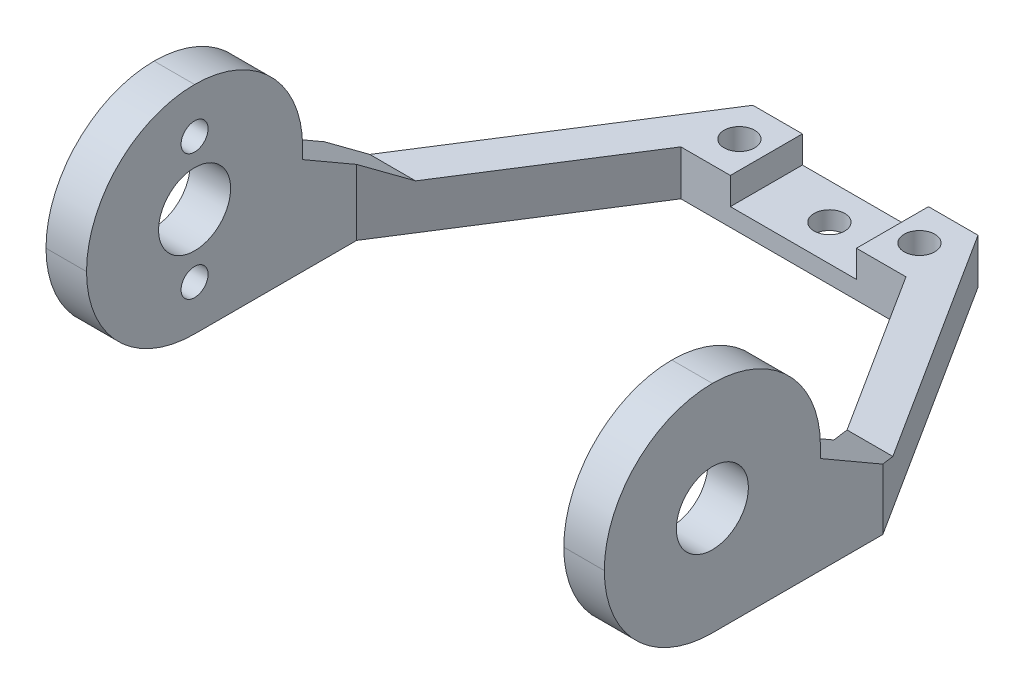
from build123d import *
from OCP.BRepFilletAPI import BRepFilletAPI_MakeChamfer

# Parameters (mm, degrees)
BOSS_EXTRUDE1_DEPTH     = 5
SKETCH2_W               = 4.5
SKETCH2_H               = 24
BOSS_EXTRUDE2_DEPTH     = 19
CUT_EXTRUDE1_REACH      = 59.853
SKETCH5_R               = 1.7
CUT_EXTRUDE2_REACH      = 73.673
SKETCH6_W               = 14
SKETCH6_H               = 3
CUT_EXTRUDE3_REACH      = 78.859
SKETCH7_R               = 1.5
CUT_EXTRUDE4_DEPTH      = 77.85863647
CUT_EXTRUDE4_DEPTH_BACK = 77.85863647
SKETCH8_R               = 4
FILLET1_R               = 12
CHAMFER2_SIZE           = 10
CHAMFER2_SIZE2          = 5.773502692
CUT_EXTRUDE5_REACH      = 59.853
SKETCH10_R              = 1.7


with BuildPart() as part:
    # Sketch1 → Boss-Extrude1 (new body)
    with BuildSketch(Plane(origin=(0, 0, 0), x_dir=(1, 0, 0), z_dir=(0, 1, 0))):
        Polygon((-31, 15.928571429), (-31, -15), (-26.5, -15), (-26.5, 15), (-12.5, 37), (12.5, 37), (26.5, 15), (26.5, -15), (31, -15), (31, 15.928571429), (12.5, 45), (-12.5, 45), align=None)
    extrude(amount=BOSS_EXTRUDE1_DEPTH)

    # Sketch2 → Boss-Extrude2 (add)
    with BuildSketch(Plane(origin=(0, 5, 0), x_dir=(1, 0, 0), z_dir=(0, 1, 0))):
        with Locations((-28.75, -3)):
            Rectangle(SKETCH2_W, SKETCH2_H)
        with Locations((28.75, -3)):
            Rectangle(SKETCH2_W, SKETCH2_H)
    extrude(amount=BOSS_EXTRUDE2_DEPTH)

    # Sketch5 → Cut-Extrude1 (cut, up to next)
    with BuildSketch(Plane(origin=(0, 5, 0), x_dir=(1, 0, 0), z_dir=(0, 1, 0)), mode=Mode.PRIVATE) as cut_extrude1_sk1:
        with Locations(Location((0, 41, 0), (0, 0, 270))):
            Circle(SKETCH5_R)
    cut_extrude1_tool1 = extrude(cut_extrude1_sk1.sketch, amount=-CUT_EXTRUDE1_REACH, mode=Mode.PRIVATE) & part.part
    add(cut_extrude1_tool1.solids().sort_by_distance((0, 5, -41))[0], mode=Mode.SUBTRACT)

    # Cut-Extrude2: up to this face of the body (flat: up to its plane)
    cut_extrude2_end = Plane(part.part.faces().sort_by_distance((0, 2.5, -37))[0])
    # Sketch6 → Cut-Extrude2 (cut, up to the picked face)
    with BuildSketch(Plane(origin=(0, 0, -45), x_dir=(-1, 0, 0), z_dir=(0, 0, -1)), mode=Mode.PRIVATE) as cut_extrude2_sk1:
        with Locations((0, 3.5)):
            Rectangle(SKETCH6_W, SKETCH6_H)
    cut_extrude2_tool1 = split(extrude(cut_extrude2_sk1.sketch, amount=-CUT_EXTRUDE2_REACH, mode=Mode.PRIVATE), bisect_by=cut_extrude2_end, keep=Keep.BOTH, mode=Mode.PRIVATE)
    add(cut_extrude2_tool1.solids().sort_by(Axis((0, 3.5, -45), (0, 0, 1)))[0], mode=Mode.SUBTRACT)

    # Sketch7 → Cut-Extrude3 (cut, up to next)
    with BuildSketch(Plane(origin=(-26.5, 0, 0), x_dir=(0, 0, -1), z_dir=(1, 0, 0)), mode=Mode.PRIVATE) as cut_extrude3_sk1:
        with Locations((-3, 19)):
            Circle(SKETCH7_R)
    cut_extrude3_tool1 = extrude(cut_extrude3_sk1.sketch, amount=-CUT_EXTRUDE3_REACH, mode=Mode.PRIVATE) & part.part
    # Sketch7 → Cut-Extrude3 (cut, up to next)
    with BuildSketch(Plane(origin=(-26.5, 0, 0), x_dir=(0, 0, -1), z_dir=(1, 0, 0)), mode=Mode.PRIVATE) as cut_extrude3_sk2:
        with Locations((-3, 5)):
            Circle(SKETCH7_R)
    cut_extrude3_tool2 = extrude(cut_extrude3_sk2.sketch, amount=-CUT_EXTRUDE3_REACH, mode=Mode.PRIVATE) & part.part
    add(cut_extrude3_tool1.solids().sort_by_distance((-26.5, 19, 3))[0], mode=Mode.SUBTRACT)
    add(cut_extrude3_tool2.solids().sort_by_distance((-26.5, 5, 3))[0], mode=Mode.SUBTRACT)

    # Sketch8 → Cut-Extrude4 (cut, two sides: drawn at the far end of the back side and taken through both)
    with BuildSketch(Plane(origin=(-26.5, 0, 0), x_dir=(0, 0, -1), z_dir=(1, 0, 0)).offset(-CUT_EXTRUDE4_DEPTH_BACK)):
        with Locations((-3, 12)):
            Circle(SKETCH8_R)
    extrude(amount=CUT_EXTRUDE4_DEPTH + CUT_EXTRUDE4_DEPTH_BACK, mode=Mode.SUBTRACT)

    # Fillet1
    fillet1_edges = [part.edges().sort_by_distance(p)[0] for p in [
        (28.75, 0, 15),
        (-28.75, 0, 15),
        (-28.75, 24, -9),
        (28.75, 24, -9),
        (28.75, 24, 15),
        (-28.75, 24, 15),
    ]]
    fillet(fillet1_edges, radius=FILLET1_R - 0.0001)  # a hair under: the kernel refuses the full size

    # Chamfer2: one chamfer whose edges measure the first distance from different faces: ONE call of the kernel's chamfer builder (chamfer() names one face for all edges)
    chamfer2_edges_1 = [part.edges().sort_by_distance(p)[0] for p in [
        (-28.75, 5, -9),
    ]]
    chamfer2_side_1 = [part.faces().sort_by_distance(p)[0] for p in [
        (-19.473621736, 5, -28.773341624),
    ]]
    chamfer2_edges_2 = [part.edges().sort_by_distance(p)[0] for p in [
        (28.75, 5, -9),
    ]]
    chamfer2_side_2 = [part.faces().sort_by_distance(p)[0] for p in [
        (19.473621736, 5, -28.773341624),
    ]]
    chamfer2 = BRepFilletAPI_MakeChamfer(part.part.solid().wrapped)
    for e in chamfer2_edges_1:
        chamfer2.Add(CHAMFER2_SIZE, CHAMFER2_SIZE2, e.wrapped, chamfer2_side_1[0].wrapped)  # the first distance lies on this face
    for e in chamfer2_edges_2:
        chamfer2.Add(CHAMFER2_SIZE, CHAMFER2_SIZE2, e.wrapped, chamfer2_side_2[0].wrapped)  # the first distance lies on this face
    add(Compound.cast(chamfer2.Shape()), mode=Mode.REPLACE)

    # Sketch10 → Cut-Extrude5 (cut, up to next)
    with BuildSketch(Plane(origin=(0, 5, 0), x_dir=(1, 0, 0), z_dir=(0, 1, 0)), mode=Mode.PRIVATE) as cut_extrude5_sk1:
        with Locations(Location((-10, 41, 0), (0, 0, 270))):
            Circle(SKETCH10_R)
    cut_extrude5_tool1 = extrude(cut_extrude5_sk1.sketch, amount=-CUT_EXTRUDE5_REACH, mode=Mode.PRIVATE) & part.part
    cut_extrude5 = cut_extrude5_tool1.solids().sort_by_distance((-10, 5, -41))[0]
    add(cut_extrude5, mode=Mode.SUBTRACT)

    # Mirror1: Cut-Extrude5 across plane
    add(cut_extrude5.mirror(Plane(origin=(0, 0, 0), x_dir=(0, 0, 1), z_dir=(1, 0, 0))), mode=Mode.SUBTRACT)


solid = part.part
